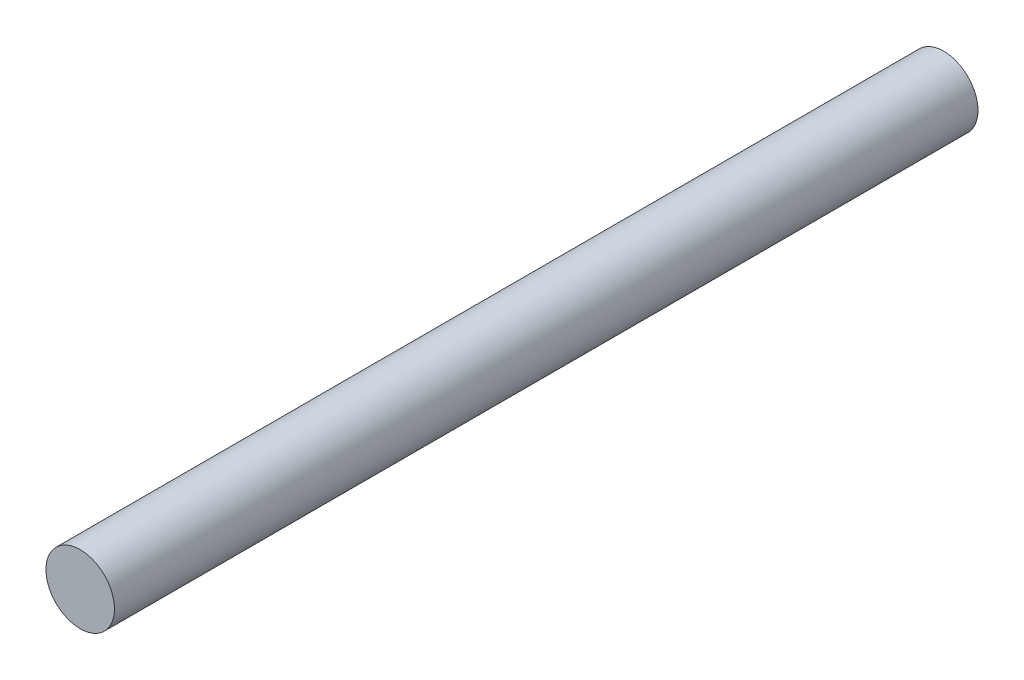
from build123d import *

# Parameters (mm, degrees)
SKETCH2_R           = 0.79375
BOSS_EXTRUDE1_DEPTH = 20


with BuildPart() as part:
    # Sketch2 → Boss-Extrude1 (new body)
    with BuildSketch(Plane.XY):
        Circle(SKETCH2_R)
    extrude(amount=BOSS_EXTRUDE1_DEPTH)


solid = part.part
